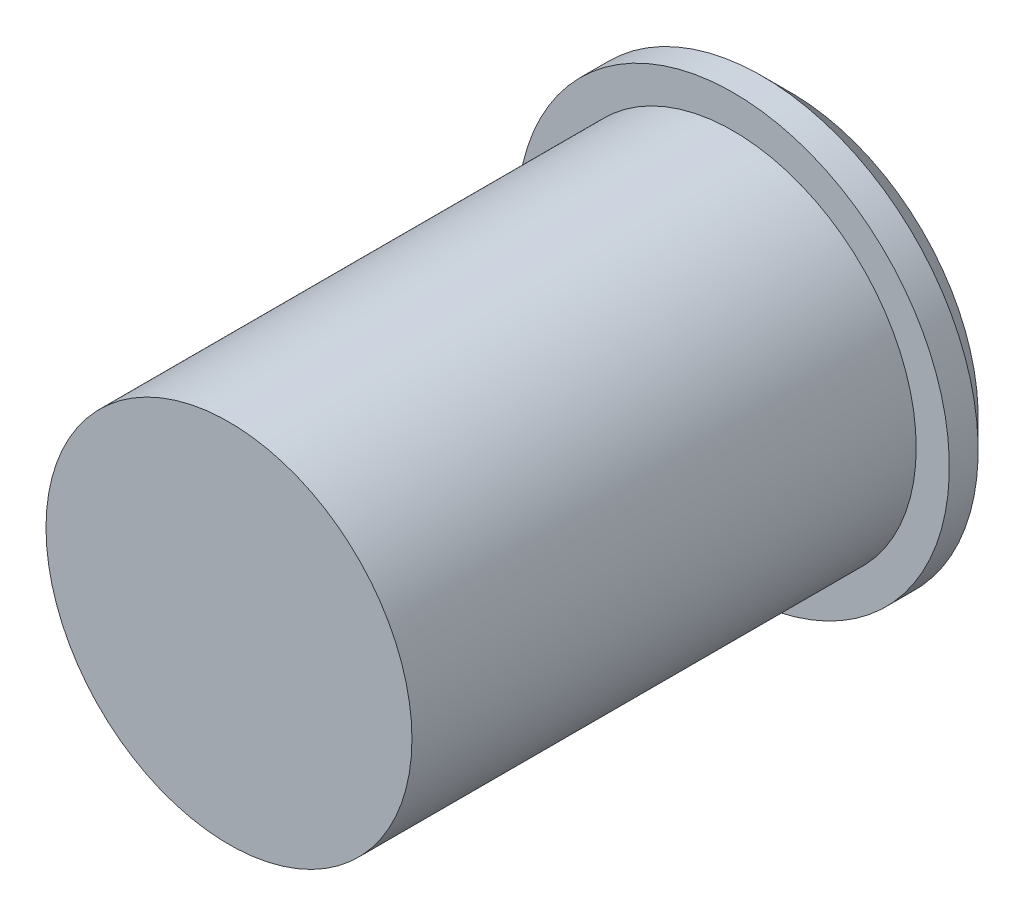
from build123d import *

# Parameters (mm, degrees)
F_3_8_0_375_DIAMETER_HOLE1_D     = 9.525
F_3_8_0_375_DIAMETER_HOLE1_DEPTH = 5.999988
F_3_8_0_375_DIAMETER_HOLE1_TIP   = 2.861598698


with BuildPart() as part:
    # Sketch1 → Revolve2 (revolve)
    with BuildSketch(Plane(origin=(0, 0, 0), x_dir=(1, 0, 0), z_dir=(0, 1, 0))):
        Polygon((0, 0), (6.35, 0), (6.35, 17.5), (7.5, 17.5), (7.5, 18.5), (6.5, 19.5), (0, 19.5), align=None)
    revolve(axis=Axis((0, 0, -19.5), (0, 0, 1)))

    # 3/8 (0.375) Diameter Hole1
    with Locations(Plane(origin=(0, 0, -19.5), x_dir=(-1, 0, 0), z_dir=(0, 0, -1))):
        with Locations((0, 0)):
            Hole(F_3_8_0_375_DIAMETER_HOLE1_D / 2, depth=F_3_8_0_375_DIAMETER_HOLE1_DEPTH)
            with Locations((0, 0, -(F_3_8_0_375_DIAMETER_HOLE1_DEPTH + F_3_8_0_375_DIAMETER_HOLE1_TIP / 2))):  # 118° drill point
                Cone(0, F_3_8_0_375_DIAMETER_HOLE1_D / 2, F_3_8_0_375_DIAMETER_HOLE1_TIP, mode=Mode.SUBTRACT)


solid = part.part
